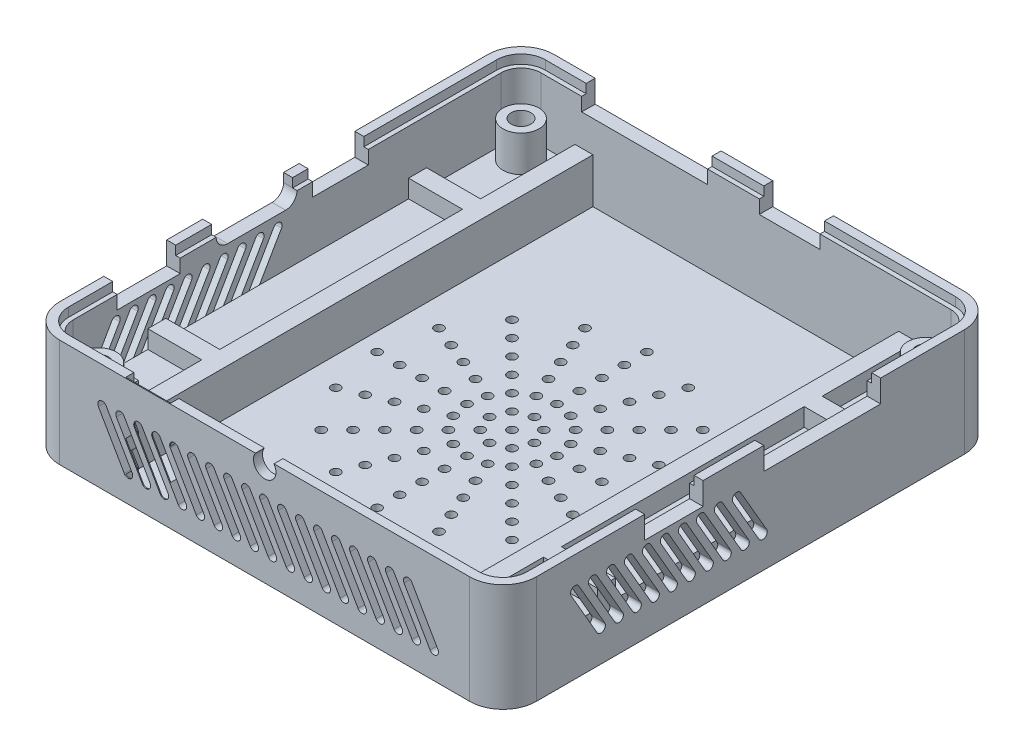
from build123d import *

# Parameters (mm, degrees)
BOSS_EXTRUDE1_DEPTH   = 12
BOSS_EXTRUDE2_DEPTH   = 11
SKETCH1_11_R          = 2
SKETCH1_11_R_2        = 1.1
BOSS_EXTRUDE3_DEPTH   = 8
BOSS_EXTRUDE3_2_DEPTH = 8
BOSS_EXTRUDE3_3_DEPTH = 8
BOSS_EXTRUDE3_4_DEPTH = 8
SKETCH1_12_R          = 2
SKETCH1_12_W          = 34
SKETCH1_12_H          = 52
SKETCH1_12_W_2        = 6
SKETCH1_12_H_2        = 27
BOSS_EXTRUDE4_DEPTH   = 4
BOSS_EXTRUDE5_DEPTH   = 6
SKETCH2_W             = 34
SKETCH2_H             = 52
CUT_EXTRUDE1_DEPTH    = 3
SKETCH3_R             = 2
SKETCH3_R_2           = 0.5
CUT_EXTRUDE2_DEPTH    = 4
SKETCH4_W             = 14
SKETCH4_H             = 2.5
SKETCH4_W_2           = 6.75
CUT_EXTRUDE3_DEPTH    = 4
SKETCH5_W             = 6.2
SKETCH5_H             = 2.5
SKETCH5_W_2           = 7
CUT_EXTRUDE4_DEPTH    = 4
SKETCH6_W             = 5
SKETCH6_H             = 11
CUT_EXTRUDE5_DEPTH    = 1
SKETCH7_W             = 13
SKETCH7_H             = 2.5
SKETCH7_W_2           = 6.5
CUT_EXTRUDE6_DEPTH    = 5
SKETCH9_R             = 1.25
CUT_EXTRUDE8_DEPTH    = 5
CUT_EXTRUDE9_DEPTH    = 1.5
SKETCH12_R            = 0.25
CUT_EXTRUDE12_DEPTH   = 1
SKETCH13_R            = 2
CUT_EXTRUDE13_DEPTH   = 0.5
CUT_EXTRUDE14_DEPTH   = 1.5
CUT_EXTRUDE15_DEPTH   = 1.5
SKETCH17_W            = 5
SKETCH17_H            = 0.8
CUT_EXTRUDE16_DEPTH   = 11


with BuildPart() as part:
    # Sketch1 → Boss-Extrude1 (new body)
    with BuildSketch(Plane(origin=(0, 0, 0), x_dir=(1, 0, 0), z_dir=(0, 1, 0))):
        with BuildLine():
            ThreePointArc((-22.8, 27.5), (-25.41629509, 26.41629509), (-26.5, 23.8))
            Line((-26.5, 23.8), (-26.5, -23.8))
            ThreePointArc((-26.5, -23.8), (-25.41629509, -26.41629509), (-22.8, -27.5))
            Line((-22.8, -27.5), (22.8, -27.5))
            ThreePointArc((22.8, -27.5), (25.41629509, -26.41629509), (26.5, -23.8))
            Line((26.5, -23.8), (26.5, 23.8))
            ThreePointArc((26.5, 23.8), (25.41629509, 26.41629509), (22.8, 27.5))
            Line((22.8, 27.5), (-22.8, 27.5))
        make_face()
        with BuildLine():
            Line((-25.5, -23.8), (-25.5, 23.8))
            ThreePointArc((-25.5, 23.8), (-24.709188309, 25.709188309), (-22.8, 26.5))
            Line((-22.8, 26.5), (22.8, 26.5))
            ThreePointArc((22.8, 26.5), (24.709188309, 25.709188309), (25.5, 23.8))
            Line((25.5, 23.8), (25.5, -23.8))
            ThreePointArc((25.5, -23.8), (24.709188309, -25.709188309), (22.8, -26.5))
            Line((22.8, -26.5), (-22.8, -26.5))
            ThreePointArc((-22.8, -26.5), (-24.709188309, -25.709188309), (-25.5, -23.8))
        make_face(mode=Mode.SUBTRACT)
    extrude(amount=BOSS_EXTRUDE1_DEPTH)

    # Sketch1<10> → Boss-Extrude2 (add)
    with BuildSketch(Plane(origin=(0, 0, 0), x_dir=(1, 0, 0), z_dir=(0, 1, 0))):
        with BuildLine():
            ThreePointArc((-22.8, 26.5), (-24.709188309, 25.709188309), (-25.5, 23.8))
            Line((-25.5, 23.8), (-25.5, -23.8))
            ThreePointArc((-25.5, -23.8), (-24.709188309, -25.709188309), (-22.8, -26.5))
            Line((-22.8, -26.5), (22.8, -26.5))
            ThreePointArc((22.8, -26.5), (24.709188309, -25.709188309), (25.5, -23.8))
            Line((25.5, -23.8), (25.5, 23.8))
            ThreePointArc((25.5, 23.8), (24.709188309, 25.709188309), (22.8, 26.5))
            Line((22.8, 26.5), (-22.8, 26.5))
        make_face()
        with BuildLine():
            ThreePointArc((-25, 23.8), (-24.355634919, 25.355634919), (-22.8, 26))
            Line((-22.8, 26), (-19, 26))
            Line((-19, 26), (-17, 26))
            Line((-17, 26), (17, 26))
            Line((17, 26), (19, 26))
            Line((19, 26), (22.8, 26))
            ThreePointArc((22.8, 26), (24.355634919, 25.355634919), (25, 23.8))
            Line((25, 23.8), (25, 15.5))
            Line((25, 15.5), (25, 13.5))
            Line((25, 13.5), (25, -13.5))
            Line((25, -13.5), (25, -15.5))
            Line((25, -15.5), (25, -23.8))
            ThreePointArc((25, -23.8), (24.355634919, -25.355634919), (22.8, -26))
            Line((22.8, -26), (19, -26))
            Line((19, -26), (17, -26))
            Line((17, -26), (-17, -26))
            Line((-17, -26), (-19, -26))
            Line((-19, -26), (-22.8, -26))
            ThreePointArc((-22.8, -26), (-24.355634919, -25.355634919), (-25, -23.8))
            Line((-25, -23.8), (-25, -15.5))
            Line((-25, -15.5), (-25, -13.5))
            Line((-25, -13.5), (-25, 13.5))
            Line((-25, 13.5), (-25, 15.5))
            Line((-25, 15.5), (-25, 23.8))
        make_face(mode=Mode.SUBTRACT)
    extrude(amount=BOSS_EXTRUDE2_DEPTH)



with BuildPart() as body_2:
    # Sketch1<11> → Boss-Extrude3 (new body)
    with BuildSketch(Plane(origin=(0, 0, 0), x_dir=(1, 0, 0), z_dir=(0, 1, 0))):
        with Locations((-22.5, 23.5)):
            Circle(SKETCH1_11_R)
        with Locations((-22.5, 23.5)):
            Circle(SKETCH1_11_R_2, mode=Mode.SUBTRACT)
    extrude(amount=BOSS_EXTRUDE3_DEPTH)


with BuildPart() as body_3:
    # Sketch1<11> → Boss-Extrude3 2 (new body)
    with BuildSketch(Plane(origin=(0, 0, 0), x_dir=(1, 0, 0), z_dir=(0, 1, 0))):
        with Locations((22.5, 23.5)):
            Circle(SKETCH1_11_R)
        with Locations((22.5, 23.5)):
            Circle(SKETCH1_11_R_2, mode=Mode.SUBTRACT)
    extrude(amount=BOSS_EXTRUDE3_2_DEPTH)


with BuildPart() as body_4:
    # Sketch1<11> → Boss-Extrude3 3 (new body)
    with BuildSketch(Plane(origin=(0, 0, 0), x_dir=(1, 0, 0), z_dir=(0, 1, 0))):
        with Locations((22.5, -23.5)):
            Circle(SKETCH1_11_R)
        with Locations((22.5, -23.5)):
            Circle(SKETCH1_11_R_2, mode=Mode.SUBTRACT)
    extrude(amount=BOSS_EXTRUDE3_3_DEPTH)


with BuildPart() as body_5:
    # Sketch1<11> → Boss-Extrude3 4 (new body)
    with BuildSketch(Plane(origin=(0, 0, 0), x_dir=(1, 0, 0), z_dir=(0, 1, 0))):
        with Locations((-22.5, -23.5)):
            Circle(SKETCH1_11_R)
        with Locations((-22.5, -23.5)):
            Circle(SKETCH1_11_R_2, mode=Mode.SUBTRACT)
    extrude(amount=BOSS_EXTRUDE3_4_DEPTH)


with BuildPart() as part_1:
    add(part.part)

    add(body_2.part)  # Boss-Extrude4 merges body 2

    add(body_3.part)  # Boss-Extrude4 merges body 3

    add(body_4.part)  # Boss-Extrude4 merges body 4

    add(body_5.part)  # Boss-Extrude4 merges body 5
    # Sketch1<12> → Boss-Extrude4 (add)
    # profile 1 of 7: a face of its own
    with BuildSketch(Plane(origin=(0, 0, 0), x_dir=(1, 0, 0), z_dir=(0, 1, 0))):
        with BuildLine():
            Line((-19, 26), (-22.8, 26))
            ThreePointArc((-22.8, 26), (-24.355634919, 25.355634919), (-25, 23.8))
            Line((-25, 23.8), (-25, 15.5))
            Line((-25, 15.5), (-19, 15.5))
            Line((-19, 15.5), (-19, 26))
        make_face()
        with Locations((-22.5, 23.5)):
            Circle(SKETCH1_12_R, mode=Mode.SUBTRACT)
    # profile 2 of 7: a face of its own
    with BuildSketch(Plane(origin=(0, 0, 0), x_dir=(1, 0, 0), z_dir=(0, 1, 0))):
        Rectangle(SKETCH1_12_W, SKETCH1_12_H)
    # profile 3 of 7: a face of its own
    with BuildSketch(Plane(origin=(0, 0, 0), x_dir=(1, 0, 0), z_dir=(0, 1, 0))):
        with Locations((-22, 0)):
            Rectangle(SKETCH1_12_W_2, SKETCH1_12_H_2)
    # profile 4 of 7: a face of its own
    with BuildSketch(Plane(origin=(0, 0, 0), x_dir=(1, 0, 0), z_dir=(0, 1, 0))):
        with BuildLine():
            Line((22.8, 26), (19, 26))
            Line((19, 26), (19, 15.5))
            Line((19, 15.5), (25, 15.5))
            Line((25, 15.5), (25, 23.8))
            ThreePointArc((25, 23.8), (24.355634919, 25.355634919), (22.8, 26))
        make_face()
        with Locations((22.5, 23.5)):
            Circle(SKETCH1_12_R, mode=Mode.SUBTRACT)
    # profile 5 of 7: a face of its own
    with BuildSketch(Plane(origin=(0, 0, 0), x_dir=(1, 0, 0), z_dir=(0, 1, 0))):
        with BuildLine():
            Line((-22.8, -26), (-19, -26))
            Line((-19, -26), (-19, -15.5))
            Line((-19, -15.5), (-25, -15.5))
            Line((-25, -15.5), (-25, -23.8))
            ThreePointArc((-25, -23.8), (-24.355634919, -25.355634919), (-22.8, -26))
        make_face()
        with Locations((-22.5, -23.5)):
            Circle(SKETCH1_12_R, mode=Mode.SUBTRACT)
    # profile 6 of 7: a face of its own
    with BuildSketch(Plane(origin=(0, 0, 0), x_dir=(1, 0, 0), z_dir=(0, 1, 0))):
        with BuildLine():
            Line((19, -15.5), (19, -26))
            Line((19, -26), (22.8, -26))
            ThreePointArc((22.8, -26), (24.355634919, -25.355634919), (25, -23.8))
            Line((25, -23.8), (25, -15.5))
            Line((25, -15.5), (19, -15.5))
        make_face()
        with Locations((22.5, -23.5)):
            Circle(SKETCH1_12_R, mode=Mode.SUBTRACT)
    # profile 7 of 7: a face of its own
    with BuildSketch(Plane(origin=(0, 0, 0), x_dir=(1, 0, 0), z_dir=(0, 1, 0))):
        with Locations((22, 0)):
            Rectangle(SKETCH1_12_W_2, SKETCH1_12_H_2)
    extrude(amount=BOSS_EXTRUDE4_DEPTH)

    # Sketch1<13> → Boss-Extrude5 (add)
    with BuildSketch(Plane(origin=(0, 0, 0), x_dir=(1, 0, 0), z_dir=(0, 1, 0))):
        Polygon((-17, 26), (-19, 26), (-19, 15.5), (-25, 15.5), (-25, 13.5), (-19, 13.5), (-19, -13.5), (-25, -13.5), (-25, -15.5), (-19, -15.5), (-19, -26), (-17, -26), align=None)
        Polygon((19, 26), (17, 26), (17, -26), (19, -26), (19, -15.5), (25, -15.5), (25, -13.5), (19, -13.5), (19, 13.5), (25, 13.5), (25, 15.5), (19, 15.5), align=None)
    extrude(amount=BOSS_EXTRUDE5_DEPTH)

    # Sketch2 → Cut-Extrude1 (cut)
    with BuildSketch(Plane(origin=(0, 4, 0), x_dir=(1, 0, 0), z_dir=(0, 1, 0))):
        Rectangle(SKETCH2_W, SKETCH2_H)
    extrude(amount=-CUT_EXTRUDE1_DEPTH, mode=Mode.SUBTRACT)

    # Sketch3 → Cut-Extrude2 (cut)
    with BuildSketch(Plane.XZ):
        with Locations((-22.5, 23.5)):
            Circle(SKETCH3_R)
        with Locations((22.5, 23.5)):
            Circle(SKETCH3_R)
        with Locations((-22.5, -23.5)):
            Circle(SKETCH3_R)
        with Locations((22.5, -23.5)):
            Circle(SKETCH3_R)
        with Locations((0, 12.5)):
            Circle(SKETCH3_R_2)
        with Locations((4.783542905, 11.548494156)):
            Circle(SKETCH3_R_2)
        with Locations((8.838834765, 8.838834765)):
            Circle(SKETCH3_R_2)
        with Locations((11.548494156, 4.783542905)):
            Circle(SKETCH3_R_2)
        with Locations((12.5, 0)):
            Circle(SKETCH3_R_2)
        with Locations((11.548494156, -4.783542905)):
            Circle(SKETCH3_R_2)
        with Locations((8.838834765, -8.838834765)):
            Circle(SKETCH3_R_2)
        with Locations((4.783542905, -11.548494156)):
            Circle(SKETCH3_R_2)
        with Locations((0, -12.5)):
            Circle(SKETCH3_R_2)
        with Locations((-4.783542905, -11.548494156)):
            Circle(SKETCH3_R_2)
        with Locations((-8.838834765, -8.838834765)):
            Circle(SKETCH3_R_2)
        with Locations((-11.548494156, -4.783542905)):
            Circle(SKETCH3_R_2)
        with Locations((-12.5, 0)):
            Circle(SKETCH3_R_2)
        with Locations((-11.548494156, 4.783542905)):
            Circle(SKETCH3_R_2)
        with Locations((-8.838834765, 8.838834765)):
            Circle(SKETCH3_R_2)
        with Locations((-4.783542905, 11.548494156)):
            Circle(SKETCH3_R_2)
        with Locations((0, 10)):
            Circle(SKETCH3_R_2)
        with Locations((0, 7.5)):
            Circle(SKETCH3_R_2)
        with Locations((0, 5)):
            Circle(SKETCH3_R_2)
        with Locations((0, 2.5)):
            Circle(SKETCH3_R_2)
        Circle(SKETCH3_R_2)
        with Locations((3.826834324, 9.238795325)):
            Circle(SKETCH3_R_2)
        with Locations((7.071067812, 7.071067812)):
            Circle(SKETCH3_R_2)
        with Locations((9.238795325, 3.826834324)):
            Circle(SKETCH3_R_2)
        with Locations((10, 0)):
            Circle(SKETCH3_R_2)
        with Locations((9.238795325, -3.826834324)):
            Circle(SKETCH3_R_2)
        with Locations((7.071067812, -7.071067812)):
            Circle(SKETCH3_R_2)
        with Locations((3.826834324, -9.238795325)):
            Circle(SKETCH3_R_2)
        with Locations((0, -10)):
            Circle(SKETCH3_R_2)
        with Locations((-3.826834324, -9.238795325)):
            Circle(SKETCH3_R_2)
        with Locations((-7.071067812, -7.071067812)):
            Circle(SKETCH3_R_2)
        with Locations((-9.238795325, -3.826834324)):
            Circle(SKETCH3_R_2)
        with Locations((-10, 0)):
            Circle(SKETCH3_R_2)
        with Locations((-9.238795325, 3.826834324)):
            Circle(SKETCH3_R_2)
        with Locations((-7.071067812, 7.071067812)):
            Circle(SKETCH3_R_2)
        with Locations((-3.826834324, 9.238795325)):
            Circle(SKETCH3_R_2)
        with Locations((2.870125743, 6.929096494)):
            Circle(SKETCH3_R_2)
        with Locations((5.303300859, 5.303300859)):
            Circle(SKETCH3_R_2)
        with Locations((6.929096494, 2.870125743)):
            Circle(SKETCH3_R_2)
        with Locations((7.5, 0)):
            Circle(SKETCH3_R_2)
        with Locations((6.929096494, -2.870125743)):
            Circle(SKETCH3_R_2)
        with Locations((5.303300859, -5.303300859)):
            Circle(SKETCH3_R_2)
        with Locations((2.870125743, -6.929096494)):
            Circle(SKETCH3_R_2)
        with Locations((0, -7.5)):
            Circle(SKETCH3_R_2)
        with Locations((-2.870125743, -6.929096494)):
            Circle(SKETCH3_R_2)
        with Locations((-5.303300859, -5.303300859)):
            Circle(SKETCH3_R_2)
        with Locations((-6.929096494, -2.870125743)):
            Circle(SKETCH3_R_2)
        with Locations((-7.5, 0)):
            Circle(SKETCH3_R_2)
        with Locations((-6.929096494, 2.870125743)):
            Circle(SKETCH3_R_2)
        with Locations((-5.303300859, 5.303300859)):
            Circle(SKETCH3_R_2)
        with Locations((-2.870125743, 6.929096494)):
            Circle(SKETCH3_R_2)
        with Locations((1.913417162, 4.619397663)):
            Circle(SKETCH3_R_2)
        with Locations((3.535533906, 3.535533906)):
            Circle(SKETCH3_R_2)
        with Locations((4.619397663, 1.913417162)):
            Circle(SKETCH3_R_2)
        with Locations((5, 0)):
            Circle(SKETCH3_R_2)
        with Locations((4.619397663, -1.913417162)):
            Circle(SKETCH3_R_2)
        with Locations((3.535533906, -3.535533906)):
            Circle(SKETCH3_R_2)
        with Locations((1.913417162, -4.619397663)):
            Circle(SKETCH3_R_2)
        with Locations((0, -5)):
            Circle(SKETCH3_R_2)
        with Locations((-1.913417162, -4.619397663)):
            Circle(SKETCH3_R_2)
        with Locations((-3.535533906, -3.535533906)):
            Circle(SKETCH3_R_2)
        with Locations((-4.619397663, -1.913417162)):
            Circle(SKETCH3_R_2)
        with Locations((-5, 0)):
            Circle(SKETCH3_R_2)
        with Locations((-4.619397663, 1.913417162)):
            Circle(SKETCH3_R_2)
        with Locations((-3.535533906, 3.535533906)):
            Circle(SKETCH3_R_2)
        with Locations((-1.913417162, 4.619397663)):
            Circle(SKETCH3_R_2)
        with Locations((1.767766953, 1.767766953)):
            Circle(SKETCH3_R_2)
        with Locations((2.5, 0)):
            Circle(SKETCH3_R_2)
        with Locations((1.767766953, -1.767766953)):
            Circle(SKETCH3_R_2)
        with Locations((0, -2.5)):
            Circle(SKETCH3_R_2)
        with Locations((-1.767766953, -1.767766953)):
            Circle(SKETCH3_R_2)
        with Locations((-2.5, 0)):
            Circle(SKETCH3_R_2)
        with Locations((-1.767766953, 1.767766953)):
            Circle(SKETCH3_R_2)
        with Locations((0, 15)):
            Circle(SKETCH3_R_2)
        with Locations((5.740251485, 13.858192988)):
            Circle(SKETCH3_R_2)
        with Locations((10.606601718, 10.606601718)):
            Circle(SKETCH3_R_2)
        with Locations((13.858192988, 5.740251485)):
            Circle(SKETCH3_R_2)
        with Locations((15, 0)):
            Circle(SKETCH3_R_2)
        with Locations((13.858192988, -5.740251485)):
            Circle(SKETCH3_R_2)
        with Locations((10.606601718, -10.606601718)):
            Circle(SKETCH3_R_2)
        with Locations((5.740251485, -13.858192988)):
            Circle(SKETCH3_R_2)
        with Locations((0, -15)):
            Circle(SKETCH3_R_2)
        with Locations((-5.740251485, -13.858192988)):
            Circle(SKETCH3_R_2)
        with Locations((-10.606601718, -10.606601718)):
            Circle(SKETCH3_R_2)
        with Locations((-13.858192988, -5.740251485)):
            Circle(SKETCH3_R_2)
        with Locations((-15, 0)):
            Circle(SKETCH3_R_2)
        with Locations((-13.858192988, 5.740251485)):
            Circle(SKETCH3_R_2)
        with Locations((-10.606601718, 10.606601718)):
            Circle(SKETCH3_R_2)
        with Locations((-5.740251485, 13.858192988)):
            Circle(SKETCH3_R_2)
    extrude(amount=-CUT_EXTRUDE2_DEPTH, mode=Mode.SUBTRACT)


with BuildPart() as cut_extrude2_piece_1:
    # of the separate pieces the step leaves, piece 1, a body of its own (cut_extrude2_pieces)
    add(part_1.part.solids().sort_by_distance((22.8, 0, -27.5))[0])

    # Sketch4 → Cut-Extrude3 (cut)
    with BuildSketch(Plane(origin=(0, 0, -27.5), x_dir=(-1, 0, 0), z_dir=(0, 0, -1))):
        with Locations((11.25, 10.75)):
            Rectangle(SKETCH4_W, SKETCH4_H)
        with Locations((-4.875, 10.75)):
            Rectangle(SKETCH4_W_2, SKETCH4_H)
    extrude(amount=-CUT_EXTRUDE3_DEPTH, mode=Mode.SUBTRACT)

    # Sketch5 → Cut-Extrude4 (cut)
    with BuildSketch(Plane.ZY.offset(26.5)):
        with Locations((-5.92, 10.75)):
            Rectangle(SKETCH5_W, SKETCH5_H)
        with BuildLine():
            Line((-1.1, 12), (7.9, 12))
            Line((7.9, 12), (7.9, 11.03))
            ThreePointArc((7.9, 11.03), (7.52509668, 10.12490332), (6.62, 9.75))
            Line((6.62, 9.75), (0.18, 9.75))
            ThreePointArc((0.18, 9.75), (-0.72509668, 10.12490332), (-1.1, 11.03))
            Line((-1.1, 11.03), (-1.1, 12))
        make_face()
        with Locations((15.4, 10.75)):
            Rectangle(SKETCH5_W_2, SKETCH5_H)
    extrude(amount=-CUT_EXTRUDE4_DEPTH, mode=Mode.SUBTRACT)

    # Sketch6 → Cut-Extrude5 (cut)
    with BuildSketch(Plane(origin=(0, 0, 26), x_dir=(-1, 0, 0), z_dir=(0, 0, -1))):
        with Locations((13.05, 6.5)):
            Rectangle(SKETCH6_W, SKETCH6_H)
    extrude(amount=-CUT_EXTRUDE5_DEPTH, mode=Mode.SUBTRACT)

    # Sketch7 → Cut-Extrude6 (cut)
    with BuildSketch(Plane(origin=(26.5, 0, 0), x_dir=(0, 0, -1), z_dir=(1, 0, 0))):
        with Locations((8, 10.75)):
            Rectangle(SKETCH7_W, SKETCH7_H)
        with Locations((-8.5, 10.75)):
            Rectangle(SKETCH7_W_2, SKETCH7_H)
    extrude(amount=-CUT_EXTRUDE6_DEPTH, mode=Mode.SUBTRACT)

    # Sketch9 → Cut-Extrude8 (cut)
    with BuildSketch(Plane.XY.offset(27.5)):
        with Locations((0, 11.29)):
            Circle(SKETCH9_R)
    extrude(amount=-CUT_EXTRUDE8_DEPTH, mode=Mode.SUBTRACT)

    # Sketch10 → Cut-Extrude9 (cut)
    with BuildSketch(Plane(origin=(26.5, 0, 0), x_dir=(0, 0, -1), z_dir=(1, 0, 0))):
        with BuildLine():
            Line((-19.066987298, 8.75), (-16.180235952, 3.75))
            ThreePointArc((-16.180235952, 3.75), (-16.363248654, 3.066987298), (-17.046261356, 3.25))
            Line((-17.046261356, 3.25), (-19.933012702, 8.25))
            ThreePointArc((-19.933012702, 8.25), (-19.75, 8.933012702), (-19.066987298, 8.75))
        make_face()
        with BuildLine():
            Line((-17.066987298, 8.75), (-14.180235952, 3.75))
            ThreePointArc((-14.180235952, 3.75), (-14.363248654, 3.066987298), (-15.046261356, 3.25))
            Line((-15.046261356, 3.25), (-17.933012702, 8.25))
            ThreePointArc((-17.933012702, 8.25), (-17.75, 8.933012702), (-17.066987298, 8.75))
        make_face()
        with BuildLine():
            Line((-15.066987298, 8.75), (-12.180235952, 3.75))
            ThreePointArc((-12.180235952, 3.75), (-12.363248654, 3.066987298), (-13.046261356, 3.25))
            Line((-13.046261356, 3.25), (-15.933012702, 8.25))
            ThreePointArc((-15.933012702, 8.25), (-15.75, 8.933012702), (-15.066987298, 8.75))
        make_face()
        with BuildLine():
            Line((-13.066987298, 8.75), (-10.180235952, 3.75))
            ThreePointArc((-10.180235952, 3.75), (-10.363248654, 3.066987298), (-11.046261356, 3.25))
            Line((-11.046261356, 3.25), (-13.933012702, 8.25))
            ThreePointArc((-13.933012702, 8.25), (-13.75, 8.933012702), (-13.066987298, 8.75))
        make_face()
        with BuildLine():
            Line((-11.066987298, 8.75), (-8.180235952, 3.75))
            ThreePointArc((-8.180235952, 3.75), (-8.363248654, 3.066987298), (-9.046261356, 3.25))
            Line((-9.046261356, 3.25), (-11.933012702, 8.25))
            ThreePointArc((-11.933012702, 8.25), (-11.75, 8.933012702), (-11.066987298, 8.75))
        make_face()
        with BuildLine():
            Line((-9.066987298, 8.75), (-6.180235952, 3.75))
            ThreePointArc((-6.180235952, 3.75), (-6.363248654, 3.066987298), (-7.046261356, 3.25))
            Line((-7.046261356, 3.25), (-9.933012702, 8.25))
            ThreePointArc((-9.933012702, 8.25), (-9.75, 8.933012702), (-9.066987298, 8.75))
        make_face()
        with BuildLine():
            Line((-7.066987298, 8.75), (-4.180235952, 3.75))
            ThreePointArc((-4.180235952, 3.75), (-4.363248654, 3.066987298), (-5.046261356, 3.25))
            Line((-5.046261356, 3.25), (-7.933012702, 8.25))
            ThreePointArc((-7.933012702, 8.25), (-7.75, 8.933012702), (-7.066987298, 8.75))
        make_face()
        with BuildLine():
            Line((-5.066987298, 8.75), (-2.180235952, 3.75))
            ThreePointArc((-2.180235952, 3.75), (-2.363248654, 3.066987298), (-3.046261356, 3.25))
            Line((-3.046261356, 3.25), (-5.933012702, 8.25))
            ThreePointArc((-5.933012702, 8.25), (-5.75, 8.933012702), (-5.066987298, 8.75))
        make_face()
        with BuildLine():
            Line((-3.066987298, 8.75), (-0.180235952, 3.75))
            ThreePointArc((-0.180235952, 3.75), (-0.363248654, 3.066987298), (-1.046261356, 3.25))
            Line((-1.046261356, 3.25), (-3.933012702, 8.25))
            ThreePointArc((-3.933012702, 8.25), (-3.75, 8.933012702), (-3.066987298, 8.75))
        make_face()
        with BuildLine():
            Line((-1.066987298, 8.75), (1.819764048, 3.75))
            ThreePointArc((1.819764048, 3.75), (1.636751346, 3.066987298), (0.953738644, 3.25))
            Line((0.953738644, 3.25), (-1.933012702, 8.25))
            ThreePointArc((-1.933012702, 8.25), (-1.75, 8.933012702), (-1.066987298, 8.75))
        make_face()
    extrude(amount=-CUT_EXTRUDE9_DEPTH, mode=Mode.SUBTRACT)

    # Sketch12 → Cut-Extrude12 (cut)
    with BuildSketch(Plane(origin=(0, 0, 26), x_dir=(-1, 0, 0), z_dir=(0, 0, -1))):
        with Locations((-2.5, 11.5)):
            Circle(SKETCH12_R)
        with Locations((2.5, 11.5)):
            Circle(SKETCH12_R)
    extrude(amount=-CUT_EXTRUDE12_DEPTH, mode=Mode.SUBTRACT)

    # Sketch13 → Cut-Extrude13 (cut)
    with BuildSketch(Plane(origin=(0, 0, 26), x_dir=(-1, 0, 0), z_dir=(0, 0, -1))):
        with Locations((0, 11.29)):
            Circle(SKETCH13_R)
    extrude(amount=-CUT_EXTRUDE13_DEPTH, mode=Mode.SUBTRACT)

    # Sketch14 → Cut-Extrude14 (cut)
    with BuildSketch(Plane.XY.offset(27.5)):
        with BuildLine():
            Line((-17.633974596, 8.25), (-14.74722325, 3.25))
            ThreePointArc((-14.74722325, 3.25), (-14.930235952, 2.566987298), (-15.613248654, 2.75))
            Line((-15.613248654, 2.75), (-18.5, 7.75))
            ThreePointArc((-18.5, 7.75), (-18.316987298, 8.433012702), (-17.633974596, 8.25))
        make_face()
        with BuildLine():
            Line((-15.633974596, 8.25), (-12.74722325, 3.25))
            ThreePointArc((-12.74722325, 3.25), (-12.930235952, 2.566987298), (-13.613248654, 2.75))
            Line((-13.613248654, 2.75), (-16.5, 7.75))
            ThreePointArc((-16.5, 7.75), (-16.316987298, 8.433012702), (-15.633974596, 8.25))
        make_face()
        with BuildLine():
            Line((-13.633974596, 8.25), (-10.74722325, 3.25))
            ThreePointArc((-10.74722325, 3.25), (-10.930235952, 2.566987298), (-11.613248654, 2.75))
            Line((-11.613248654, 2.75), (-14.5, 7.75))
            ThreePointArc((-14.5, 7.75), (-14.316987298, 8.433012702), (-13.633974596, 8.25))
        make_face()
        with BuildLine():
            Line((-11.633974596, 8.25), (-8.74722325, 3.25))
            ThreePointArc((-8.74722325, 3.25), (-8.930235952, 2.566987298), (-9.613248654, 2.75))
            Line((-9.613248654, 2.75), (-12.5, 7.75))
            ThreePointArc((-12.5, 7.75), (-12.316987298, 8.433012702), (-11.633974596, 8.25))
        make_face()
        with BuildLine():
            Line((-9.633974596, 8.25), (-6.74722325, 3.25))
            ThreePointArc((-6.74722325, 3.25), (-6.930235952, 2.566987298), (-7.613248654, 2.75))
            Line((-7.613248654, 2.75), (-10.5, 7.75))
            ThreePointArc((-10.5, 7.75), (-10.316987298, 8.433012702), (-9.633974596, 8.25))
        make_face()
        with BuildLine():
            Line((-7.633974596, 8.25), (-4.74722325, 3.25))
            ThreePointArc((-4.74722325, 3.25), (-4.930235952, 2.566987298), (-5.613248654, 2.75))
            Line((-5.613248654, 2.75), (-8.5, 7.75))
            ThreePointArc((-8.5, 7.75), (-8.316987298, 8.433012702), (-7.633974596, 8.25))
        make_face()
        with BuildLine():
            Line((-5.633974596, 8.25), (-2.74722325, 3.25))
            ThreePointArc((-2.74722325, 3.25), (-2.930235952, 2.566987298), (-3.613248654, 2.75))
            Line((-3.613248654, 2.75), (-6.5, 7.75))
            ThreePointArc((-6.5, 7.75), (-6.316987298, 8.433012702), (-5.633974596, 8.25))
        make_face()
        with BuildLine():
            Line((-3.633974596, 8.25), (-0.74722325, 3.25))
            ThreePointArc((-0.74722325, 3.25), (-0.930235952, 2.566987298), (-1.613248654, 2.75))
            Line((-1.613248654, 2.75), (-4.5, 7.75))
            ThreePointArc((-4.5, 7.75), (-4.316987298, 8.433012702), (-3.633974596, 8.25))
        make_face()
        with BuildLine():
            Line((-1.633974596, 8.25), (1.25277675, 3.25))
            ThreePointArc((1.25277675, 3.25), (1.069764048, 2.566987298), (0.386751346, 2.75))
            Line((0.386751346, 2.75), (-2.5, 7.75))
            ThreePointArc((-2.5, 7.75), (-2.316987298, 8.433012702), (-1.633974596, 8.25))
        make_face()
        with BuildLine():
            Line((0.366025404, 8.25), (3.25277675, 3.25))
            ThreePointArc((3.25277675, 3.25), (3.069764048, 2.566987298), (2.386751346, 2.75))
            Line((2.386751346, 2.75), (-0.5, 7.75))
            ThreePointArc((-0.5, 7.75), (-0.316987298, 8.433012702), (0.366025404, 8.25))
        make_face()
        with BuildLine():
            Line((2.366025404, 8.25), (5.25277675, 3.25))
            ThreePointArc((5.25277675, 3.25), (5.069764048, 2.566987298), (4.386751346, 2.75))
            Line((4.386751346, 2.75), (1.5, 7.75))
            ThreePointArc((1.5, 7.75), (1.683012702, 8.433012702), (2.366025404, 8.25))
        make_face()
        with BuildLine():
            Line((4.366025404, 8.25), (7.25277675, 3.25))
            ThreePointArc((7.25277675, 3.25), (7.069764048, 2.566987298), (6.386751346, 2.75))
            Line((6.386751346, 2.75), (3.5, 7.75))
            ThreePointArc((3.5, 7.75), (3.683012702, 8.433012702), (4.366025404, 8.25))
        make_face()
        with BuildLine():
            Line((6.366025404, 8.25), (9.25277675, 3.25))
            ThreePointArc((9.25277675, 3.25), (9.069764048, 2.566987298), (8.386751346, 2.75))
            Line((8.386751346, 2.75), (5.5, 7.75))
            ThreePointArc((5.5, 7.75), (5.683012702, 8.433012702), (6.366025404, 8.25))
        make_face()
        with BuildLine():
            Line((8.366025404, 8.25), (11.25277675, 3.25))
            ThreePointArc((11.25277675, 3.25), (11.069764048, 2.566987298), (10.386751346, 2.75))
            Line((10.386751346, 2.75), (7.5, 7.75))
            ThreePointArc((7.5, 7.75), (7.683012702, 8.433012702), (8.366025404, 8.25))
        make_face()
        with BuildLine():
            Line((10.366025404, 8.25), (13.25277675, 3.25))
            ThreePointArc((13.25277675, 3.25), (13.069764048, 2.566987298), (12.386751346, 2.75))
            Line((12.386751346, 2.75), (9.5, 7.75))
            ThreePointArc((9.5, 7.75), (9.683012702, 8.433012702), (10.366025404, 8.25))
        make_face()
        with BuildLine():
            Line((12.366025404, 8.25), (15.25277675, 3.25))
            ThreePointArc((15.25277675, 3.25), (15.069764048, 2.566987298), (14.386751346, 2.75))
            Line((14.386751346, 2.75), (11.5, 7.75))
            ThreePointArc((11.5, 7.75), (11.683012702, 8.433012702), (12.366025404, 8.25))
        make_face()
        with BuildLine():
            Line((14.366025404, 8.25), (17.25277675, 3.25))
            ThreePointArc((17.25277675, 3.25), (17.069764048, 2.566987298), (16.386751346, 2.75))
            Line((16.386751346, 2.75), (13.5, 7.75))
            ThreePointArc((13.5, 7.75), (13.683012702, 8.433012702), (14.366025404, 8.25))
        make_face()
        with BuildLine():
            Line((16.366025404, 8.25), (19.25277675, 3.25))
            ThreePointArc((19.25277675, 3.25), (19.069764048, 2.566987298), (18.386751346, 2.75))
            Line((18.386751346, 2.75), (15.5, 7.75))
            ThreePointArc((15.5, 7.75), (15.683012702, 8.433012702), (16.366025404, 8.25))
        make_face()
    extrude(amount=-CUT_EXTRUDE14_DEPTH, mode=Mode.SUBTRACT)

    # Sketch15 → Cut-Extrude15 (cut)
    with BuildSketch(Plane.ZY.offset(26.5)):
        with BuildLine():
            Line((19.5, 8.75), (22.386751346, 3.75))
            ThreePointArc((22.386751346, 3.75), (22.203738644, 3.066987298), (21.520725942, 3.25))
            Line((21.520725942, 3.25), (18.633974596, 8.25))
            ThreePointArc((18.633974596, 8.25), (18.816987298, 8.933012702), (19.5, 8.75))
        make_face()
        with BuildLine():
            Line((17.5, 8.75), (20.386751346, 3.75))
            ThreePointArc((20.386751346, 3.75), (20.203738644, 3.066987298), (19.520725942, 3.25))
            Line((19.520725942, 3.25), (16.633974596, 8.25))
            ThreePointArc((16.633974596, 8.25), (16.816987298, 8.933012702), (17.5, 8.75))
        make_face()
        with BuildLine():
            Line((15.5, 8.75), (18.386751346, 3.75))
            ThreePointArc((18.386751346, 3.75), (18.203738644, 3.066987298), (17.520725942, 3.25))
            Line((17.520725942, 3.25), (14.633974596, 8.25))
            ThreePointArc((14.633974596, 8.25), (14.816987298, 8.933012702), (15.5, 8.75))
        make_face()
        with BuildLine():
            Line((13.5, 8.75), (16.386751346, 3.75))
            ThreePointArc((16.386751346, 3.75), (16.203738644, 3.066987298), (15.520725942, 3.25))
            Line((15.520725942, 3.25), (12.633974596, 8.25))
            ThreePointArc((12.633974596, 8.25), (12.816987298, 8.933012702), (13.5, 8.75))
        make_face()
        with BuildLine():
            Line((11.5, 8.75), (14.386751346, 3.75))
            ThreePointArc((14.386751346, 3.75), (14.203738644, 3.066987298), (13.520725942, 3.25))
            Line((13.520725942, 3.25), (10.633974596, 8.25))
            ThreePointArc((10.633974596, 8.25), (10.816987298, 8.933012702), (11.5, 8.75))
        make_face()
        with BuildLine():
            Line((9.5, 8.75), (12.386751346, 3.75))
            ThreePointArc((12.386751346, 3.75), (12.203738644, 3.066987298), (11.520725942, 3.25))
            Line((11.520725942, 3.25), (8.633974596, 8.25))
            ThreePointArc((8.633974596, 8.25), (8.816987298, 8.933012702), (9.5, 8.75))
        make_face()
        with BuildLine():
            Line((7.5, 8.75), (10.386751346, 3.75))
            ThreePointArc((10.386751346, 3.75), (10.203738644, 3.066987298), (9.520725942, 3.25))
            Line((9.520725942, 3.25), (6.633974596, 8.25))
            ThreePointArc((6.633974596, 8.25), (6.816987298, 8.933012702), (7.5, 8.75))
        make_face()
        with BuildLine():
            Line((5.5, 8.75), (8.386751346, 3.75))
            ThreePointArc((8.386751346, 3.75), (8.203738644, 3.066987298), (7.520725942, 3.25))
            Line((7.520725942, 3.25), (4.633974596, 8.25))
            ThreePointArc((4.633974596, 8.25), (4.816987298, 8.933012702), (5.5, 8.75))
        make_face()
        with BuildLine():
            Line((3.5, 8.75), (6.386751346, 3.75))
            ThreePointArc((6.386751346, 3.75), (6.203738644, 3.066987298), (5.520725942, 3.25))
            Line((5.520725942, 3.25), (2.633974596, 8.25))
            ThreePointArc((2.633974596, 8.25), (2.816987298, 8.933012702), (3.5, 8.75))
        make_face()
        with BuildLine():
            Line((1.5, 8.75), (4.386751346, 3.75))
            ThreePointArc((4.386751346, 3.75), (4.203738644, 3.066987298), (3.520725942, 3.25))
            Line((3.520725942, 3.25), (0.633974596, 8.25))
            ThreePointArc((0.633974596, 8.25), (0.816987298, 8.933012702), (1.5, 8.75))
        make_face()
    extrude(amount=-CUT_EXTRUDE15_DEPTH, mode=Mode.SUBTRACT)

    # Sketch17 → Cut-Extrude16 (cut)
    with BuildSketch(Plane(origin=(0, 12, 0), x_dir=(1, 0, 0), z_dir=(0, 1, 0))):
        with Locations((-13.05, -27)):
            Rectangle(SKETCH17_W, SKETCH17_H)
    extrude(amount=-CUT_EXTRUDE16_DEPTH, mode=Mode.SUBTRACT)


with BuildPart() as cut_extrude2_piece_2:
    # of the separate pieces the step leaves, piece 2, a body of its own (cut_extrude2_pieces)
    add(part_1.part.solids().sort_by_distance((24.5, 8, -23.5))[0])


with BuildPart() as cut_extrude2_piece_3:
    # of the separate pieces the step leaves, piece 3, a body of its own (cut_extrude2_pieces)
    add(part_1.part.solids().sort_by_distance((-20.5, 8, 23.5))[0])


with BuildPart() as cut_extrude2_piece_4:
    # of the separate pieces the step leaves, piece 4, a body of its own (cut_extrude2_pieces)
    add(part_1.part.solids().sort_by_distance((24.5, 8, 23.5))[0])


with BuildPart() as cut_extrude2_piece_5:
    # of the separate pieces the step leaves, piece 5, a body of its own (cut_extrude2_pieces)
    add(part_1.part.solids().sort_by_distance((-20.5, 8, -23.5))[0])


solid = Compound([cut_extrude2_piece_1.part, cut_extrude2_piece_2.part, cut_extrude2_piece_3.part, cut_extrude2_piece_4.part, cut_extrude2_piece_5.part])
